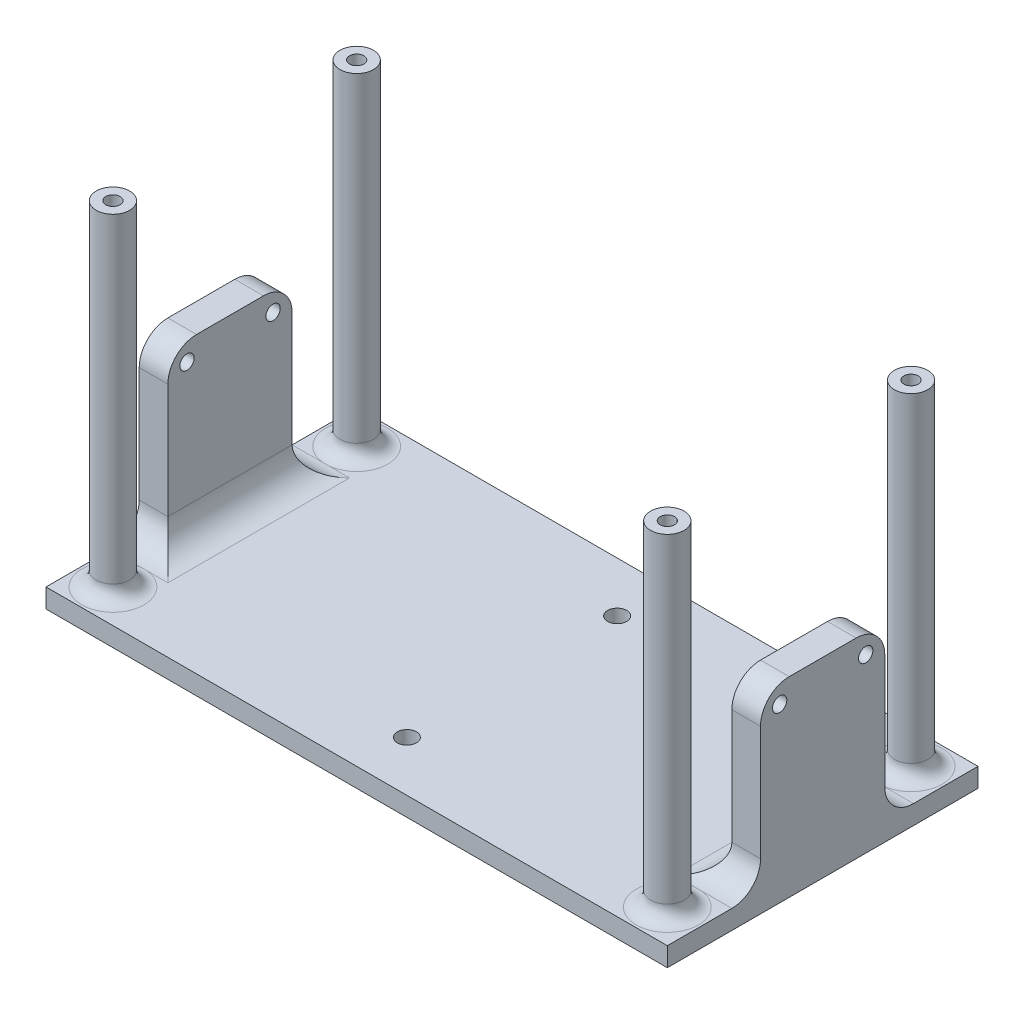
from build123d import *

# Parameters (mm, degrees)
SKETCH1_W            = 130
SKETCH1_H            = 65
BOSS_EXTRUDE1_DEPTH  = 4
SKETCH4_R            = 3.5
SKETCH4_R_2          = 1.5
BOSS_EXTRUDE3_DEPTH  = 70
SKETCH5_2_W          = 6
SKETCH5_2_H          = 26
BOSS_EXTRUDE5_DEPTH  = 36
SKETCH5_W            = 6
SKETCH5_H            = 26
BOSS_EXTRUDE4_DEPTH  = 36
SKETCH7_R            = 1.5
CUT_EXTRUDE2_DEPTH   = 10
FILLET1_R            = 6
FILLET1_OF_MIRROR1_R = 6
SKETCH10_R           = 2
CUT_EXTRUDE3_DEPTH   = 10
FILLET2_R            = 3


with BuildPart() as part:
    # Sketch1 → Boss-Extrude1 (new body)
    with BuildSketch(Plane(origin=(0, 0, 0), x_dir=(1, 0, 0), z_dir=(0, 1, 0))):
        Rectangle(SKETCH1_W, SKETCH1_H)
    extrude(amount=-BOSS_EXTRUDE1_DEPTH)

    # Sketch4 → Boss-Extrude3 (add)
    # profile 1 of 4: a face of its own
    with BuildSketch(Plane(origin=(0, 0, 0), x_dir=(1, 0, 0), z_dir=(0, 1, 0))):
        with Locations(Location((-58, 25.5, 0), (0, 0, 270))):
            Circle(SKETCH4_R)
        with Locations(Location((-58, 25.5, 0), (0, 0, 270))):
            Circle(SKETCH4_R_2, mode=Mode.SUBTRACT)
    # profile 2 of 4: a face of its own
    with BuildSketch(Plane(origin=(0, 0, 0), x_dir=(1, 0, 0), z_dir=(0, 1, 0))):
        with Locations(Location((58, 25.5, 0), (0, 0, 270))):
            Circle(SKETCH4_R)
        with Locations(Location((58, 25.5, 0), (0, 0, 270))):
            Circle(SKETCH4_R_2, mode=Mode.SUBTRACT)
    # profile 3 of 4: a face of its own
    with BuildSketch(Plane(origin=(0, 0, 0), x_dir=(1, 0, 0), z_dir=(0, 1, 0))):
        with Locations(Location((-58, -25.5, 0), (0, 0, 270))):
            Circle(SKETCH4_R)
        with Locations(Location((-58, -25.5, 0), (0, 0, 270))):
            Circle(SKETCH4_R_2, mode=Mode.SUBTRACT)
    # profile 4 of 4: a face of its own
    with BuildSketch(Plane(origin=(0, 0, 0), x_dir=(1, 0, 0), z_dir=(0, 1, 0))):
        with Locations(Location((58, -25.5, 0), (0, 0, 270))):
            Circle(SKETCH4_R)
        with Locations(Location((58, -25.5, 0), (0, 0, 270))):
            Circle(SKETCH4_R_2, mode=Mode.SUBTRACT)
    extrude(amount=BOSS_EXTRUDE3_DEPTH)

    # Sketch5<2> → Boss-Extrude5 (add)
    with BuildSketch(Plane(origin=(0, 0, 0), x_dir=(1, 0, 0), z_dir=(0, 1, 0))):
        with Locations((62, 0)):
            Rectangle(SKETCH5_2_W, SKETCH5_2_H)
    boss_extrude5 = extrude(amount=BOSS_EXTRUDE5_DEPTH)

    # Sketch5 → Boss-Extrude4 (add)
    with BuildSketch(Plane(origin=(0, 0, 0), x_dir=(1, 0, 0), z_dir=(0, 1, 0))):
        with Locations((62, 0)):
            Rectangle(SKETCH5_W, SKETCH5_H)
    extrude(amount=BOSS_EXTRUDE4_DEPTH)

    # Sketch7 → Cut-Extrude2 (cut)
    with BuildSketch(Plane(origin=(65, 0, 0), x_dir=(0, 0, -1), z_dir=(1, 0, 0))):
        with Locations((-9, 32)):
            Circle(SKETCH7_R)
        with Locations((9, 32)):
            Circle(SKETCH7_R)
    cut_extrude2 = extrude(amount=-CUT_EXTRUDE2_DEPTH, mode=Mode.SUBTRACT)

    # Fillet1
    fillet1_edges = [part.edges().sort_by_distance(p)[0] for p in [
        (62, 0, -13),
        (59, 0, 0),
        (62, 0, 13),
        (62, 36, -13),
        (62, 36, 13),
    ]]
    fillet(fillet1_edges, radius=FILLET1_R)

    # Mirror1: Boss-Extrude5, Cut-Extrude2 across plane
    add(boss_extrude5.mirror(Plane(origin=(0, 0, 0), x_dir=(0, 0, 1), z_dir=(1, 0, 0))))
    add(cut_extrude2.mirror(Plane(origin=(0, 0, 0), x_dir=(0, 0, 1), z_dir=(1, 0, 0))), mode=Mode.SUBTRACT)

    # Fillet1 of Mirror1
    fillet1_of_mirror1_edges = [part.edges().sort_by_distance(p)[0] for p in [
        (-62, 0, -13),
        (-59, 0, 0),
        (-62, 0, 13),
        (-62, 36, -13),
        (-62, 36, 13),
    ]]
    fillet(fillet1_of_mirror1_edges, radius=FILLET1_OF_MIRROR1_R)

    # Sketch10 → Cut-Extrude3 (cut)
    with BuildSketch(Plane(origin=(0, 0, 0), x_dir=(1, 0, 0), z_dir=(0, 1, 0))):
        with Locations(Location((0, 22, 0), (0, 0, 270))):
            Circle(SKETCH10_R)
        with Locations(Location((0, -22, 0), (0, 0, 270))):
            Circle(SKETCH10_R)
    extrude(amount=-CUT_EXTRUDE3_DEPTH, mode=Mode.SUBTRACT)

    # Fillet2
    fillet2_edges = [part.edges().sort_by_distance(p)[0] for p in [
        (-58, 0, -29),
        (58, 0, -29),
        (-58, 0, 22),
        (58, 0, 22),
    ]]
    fillet(fillet2_edges, radius=FILLET2_R - 0.0001)  # a hair under: the kernel refuses the full size


solid = part.part
